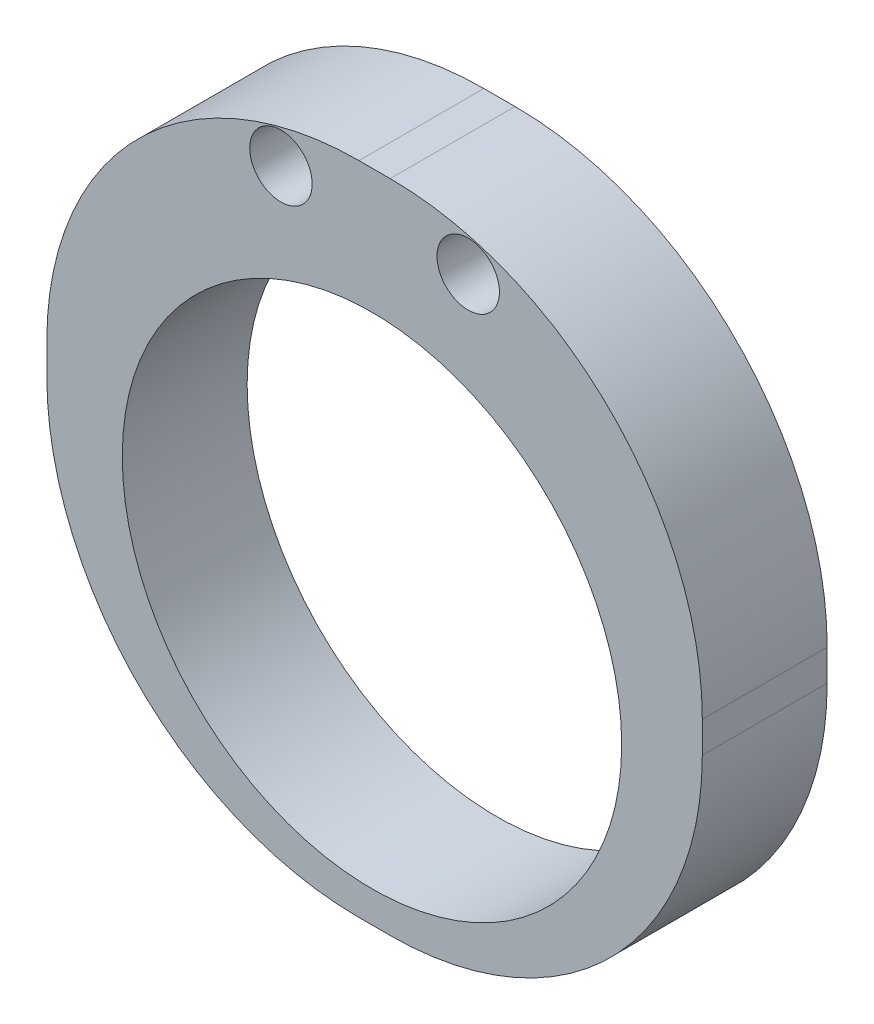
from build123d import *

# Parameters (mm, degrees)
SKETCH1_W           = 105
SKETCH1_H           = 105
BOSS_EXTRUDE1_DEPTH = 20
HOLE5_OUTLINE_R     = 40
HOLE5_DEPTH         = 20
SKETCH14_R          = 5
CUT_EXTRUDE2_DEPTH  = 20
LPATTERN2_COUNT     = 2
LPATTERN2_PITCH     = 30
FILLET3_R           = 50


# Read off the part's stored shape, not the designer's step: Hole5
with BuildPart() as part:
    # Sketch1 → Boss-Extrude1 (new body)
    with BuildSketch(Plane(origin=(-15.357562319, 50.523240315, 0), x_dir=(1, 0, 0), z_dir=(0, 0, 1))):
        with Locations((-36.920942408, -46.377068063)):
            Rectangle(SKETCH1_W, SKETCH1_H)
    extrude(amount=BOSS_EXTRUDE1_DEPTH)

    # Hole5 outline → Hole5 (cut)
    with BuildSketch(Plane.XY):
        with Locations((-52.692198598, -3.343760422)):
            Circle(HOLE5_OUTLINE_R)
    extrude(amount=HOLE5_DEPTH, mode=Mode.SUBTRACT)

    # Sketch14 → Cut-Extrude2 (cut)
    with BuildSketch(Plane(origin=(0, 0, 0), x_dir=(-1, 0, 0), z_dir=(0, 0, -1))):
        with Locations((37.278504727, 49.646172252)):
            Circle(SKETCH14_R)
    cut_extrude2 = extrude(amount=-CUT_EXTRUDE2_DEPTH, mode=Mode.SUBTRACT)

    # LPattern2: Cut-Extrude2 ×2
    with Locations(*[(-i * LPATTERN2_PITCH, 0, 0) for i in range(1, LPATTERN2_COUNT)]):
        add(cut_extrude2, mode=Mode.SUBTRACT)

    # Fillet3
    fillet3_edges = [part.edges().sort_by_distance(p)[0] for p in [
        (-104.778504727, 56.646172252, 10),
        (0.221495273, 56.646172252, 10),
        (0.221495273, -48.353827748, 10),
        (-104.778504727, -48.353827748, 10),
    ]]
    fillet(fillet3_edges, radius=FILLET3_R)


solid = part.part
